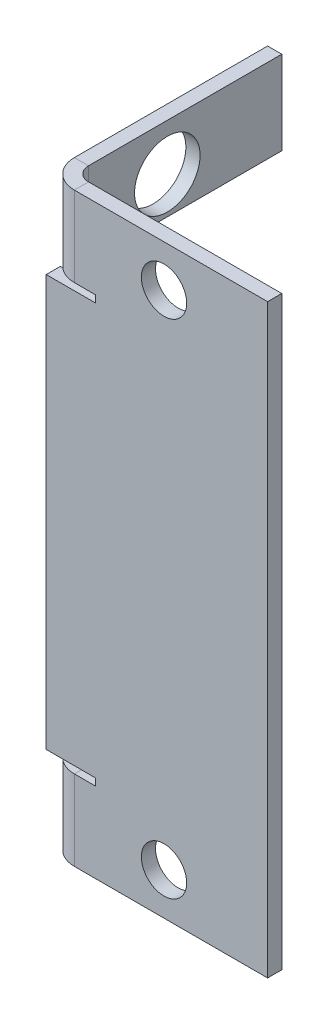
from build123d import *

# Parameters (mm, degrees)
BOSS_EXTRUDE1_DEPTH    = 42
SKETCH4_W              = 14.859
SKETCH4_H              = 30
CUT_EXTRUDE2_DEPTH     = 6.35
SKETCH6_R              = 2.35
CUT_EXTRUDE3_DEPTH     = 6.35
CUT_EXTRUDE4_REACH     = 49.295
SKETCH7_R              = 1.625
CONVERT_SOLID1_DEPTH   = 6.254
CONVERT_SOLID1_START   = 35.746
CONVERT_SOLID1_2_DEPTH = 6.254
CONVERT_SOLID1_START_2 = 5.746
CONVERT_SOLID1_3_DEPTH = 0.508
CONVERT_SOLID1_4_DEPTH = 0.508
CONVERT_SOLID1_5_DEPTH = 5.746
CONVERT_SOLID1_START_3 = 36.254
CONVERT_SOLID1_6_DEPTH = 5.746


# Read off the part's stored shape, not the designer's step: Convert-Solid1
with BuildPart() as part:
    # Sketch1 → Boss-Extrude1 (new body)
    with BuildSketch(Plane(origin=(0, 0, 0), x_dir=(1, 0, 0), z_dir=(0, 1, 0))):
        Polygon((0, 0), (15.875, 0), (15.875, 1.016), (1.016, 1.016), (1.016, 15.875), (0, 15.875), align=None)
    extrude(amount=BOSS_EXTRUDE1_DEPTH)

    # Sketch4 → Cut-Extrude2 (cut)
    with BuildSketch(Plane(origin=(1.016, 0, 0), x_dir=(0, 0, -1), z_dir=(1, 0, 0))):
        with Locations((8.4455, 21)):
            Rectangle(SKETCH4_W, SKETCH4_H)
    extrude(amount=-CUT_EXTRUDE2_DEPTH, mode=Mode.SUBTRACT)

    # Sketch6 → Cut-Extrude3 (cut)
    with BuildSketch(Plane(origin=(1.016, 0, 0), x_dir=(0, 0, -1), z_dir=(1, 0, 0))):
        with Locations((7.666, 3.35)):
            Circle(SKETCH6_R)
        with Locations((7.666, 38.65)):
            Circle(SKETCH6_R)
    extrude(amount=-CUT_EXTRUDE3_DEPTH, mode=Mode.SUBTRACT)

    # Sketch7 → Cut-Extrude4 (cut, up to next)
    with BuildSketch(Plane(origin=(0, 0, -1.016), x_dir=(-1, 0, 0), z_dir=(0, 0, -1)), mode=Mode.PRIVATE) as cut_extrude4_sk1:
        with Locations((-8.4455, 39)):
            Circle(SKETCH7_R)
    cut_extrude4_tool1 = extrude(cut_extrude4_sk1.sketch, amount=-CUT_EXTRUDE4_REACH, mode=Mode.PRIVATE) & part.part
    # Sketch7 → Cut-Extrude4 (cut, up to next)
    with BuildSketch(Plane(origin=(0, 0, -1.016), x_dir=(-1, 0, 0), z_dir=(0, 0, -1)), mode=Mode.PRIVATE) as cut_extrude4_sk2:
        with Locations((-8.4455, 3)):
            Circle(SKETCH7_R)
    cut_extrude4_tool2 = extrude(cut_extrude4_sk2.sketch, amount=-CUT_EXTRUDE4_REACH, mode=Mode.PRIVATE) & part.part
    add(cut_extrude4_tool1.solids().sort_by_distance((8.4455, 39, -1.016))[0], mode=Mode.SUBTRACT)
    add(cut_extrude4_tool2.solids().sort_by_distance((8.4455, 3, -1.016))[0], mode=Mode.SUBTRACT)

    # Convert-Solid1 outline → Convert-Solid1 (cut)
    with BuildSketch(Plane(origin=(0, 0, 0), x_dir=(1, 0, 0), z_dir=(0, 1, 0))):
        with BuildLine():
            Line((0, 0), (2.016, 0))
            ThreePointArc((2.016, 0), (0.590472729, 0.590472729), (0, 2.016))
            Line((0, 2.016), (0, 0))
        make_face()
    extrude(amount=CONVERT_SOLID1_DEPTH, mode=Mode.SUBTRACT)

    # Convert-Solid1 2 outline → Convert-Solid1 2 (cut)
    with BuildSketch(Plane(origin=(0, 0, 0), x_dir=(1, 0, 0), z_dir=(0, 1, 0)).offset(CONVERT_SOLID1_START)):
        with BuildLine():
            Line((0, 0), (2.016, 0))
            ThreePointArc((2.016, 0), (0.590472729, 0.590472729), (0, 2.016))
            Line((0, 2.016), (0, 0))
        make_face()
    extrude(amount=CONVERT_SOLID1_2_DEPTH, mode=Mode.SUBTRACT)

    # Convert-Solid1 3 outline → Convert-Solid1 3 (cut)
    with BuildSketch(Plane(origin=(0, 0, 0), x_dir=(1, 0, 0), z_dir=(0, 1, 0)).offset(CONVERT_SOLID1_START_2)):
        with BuildLine():
            Line((2.016, 0), (3.54, 0))
            Line((3.54, 0), (3.54, 1.016))
            Line((3.54, 1.016), (1.016, 1.016))
            Line((1.016, 1.016), (1.016, 3.54))
            Line((1.016, 3.54), (0, 3.54))
            Line((0, 3.54), (0, 2.016))
            ThreePointArc((0, 2.016), (0.590472729, 0.590472729), (2.016, 0))
        make_face()
    extrude(amount=CONVERT_SOLID1_3_DEPTH, mode=Mode.SUBTRACT)

    # Convert-Solid1 4 outline → Convert-Solid1 4 (cut)
    with BuildSketch(Plane(origin=(0, 0, 0), x_dir=(1, 0, 0), z_dir=(0, 1, 0)).offset(CONVERT_SOLID1_START)):
        with BuildLine():
            Line((2.016, 0), (3.54, 0))
            Line((3.54, 0), (3.54, 1.016))
            Line((3.54, 1.016), (1.016, 1.016))
            Line((1.016, 1.016), (1.016, 3.54))
            Line((1.016, 3.54), (0, 3.54))
            Line((0, 3.54), (0, 2.016))
            ThreePointArc((0, 2.016), (0.590472729, 0.590472729), (2.016, 0))
        make_face()
    extrude(amount=CONVERT_SOLID1_4_DEPTH, mode=Mode.SUBTRACT)

    # Convert-Solid1 5 outline → Convert-Solid1 5 (add)
    with BuildSketch(Plane(origin=(0, 0, 0), x_dir=(1, 0, 0), z_dir=(0, 1, 0))):
        with BuildLine():
            Line((1.016, 1.016), (2.016, 1.016))
            ThreePointArc((2.016, 1.016), (1.308893219, 1.308893219), (1.016, 2.016))
            Line((1.016, 2.016), (1.016, 1.016))
        make_face()
    extrude(amount=CONVERT_SOLID1_5_DEPTH)

    # Convert-Solid1 6 outline → Convert-Solid1 6 (add)
    with BuildSketch(Plane(origin=(0, 0, 0), x_dir=(1, 0, 0), z_dir=(0, 1, 0)).offset(CONVERT_SOLID1_START_3)):
        with BuildLine():
            Line((1.016, 1.016), (2.016, 1.016))
            ThreePointArc((2.016, 1.016), (1.308893219, 1.308893219), (1.016, 2.016))
            Line((1.016, 2.016), (1.016, 1.016))
        make_face()
    extrude(amount=CONVERT_SOLID1_6_DEPTH)


solid = part.part
